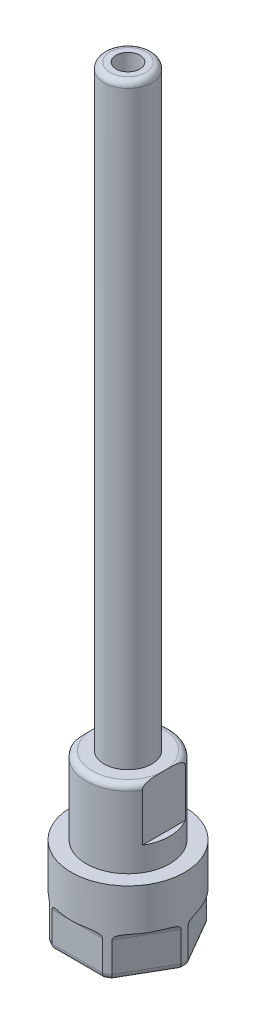
from build123d import *

# Parameters (mm, degrees)
ESQUISSE2_R             = 4
ENL_V_MAT_EXTRU_1_DEPTH = 8
ENL_V_START             = -9
ENL_V_MAT_EXTRU_2_DEPTH = 9
ESQUISSE4_R             = 15
ENL_V_MAT_EXTRU_3_DEPTH = 7
CONG_1_R                = 1


with BuildPart() as part:
    # Esquisse1 → Révolution1 (revolve)
    with BuildSketch(Plane.XY, mode=Mode.PRIVATE) as r_volution1_sk:
        Polygon((4, 127), (4, 27), (7, 27), (7, 14), (9.5, 14), (9.5, 0), (0, 0), (0, 121), (2, 123), (2, 127), align=None)
    revolve(r_volution1_sk.sketch.rotate(Axis((0, 0, 0), (0, 1, 0)), 90), axis=Axis((0, 0, 0), (0, 1, 0)))

    # Esquisse2 → Enlèv. mat.-Extru.1 (cut)
    with BuildSketch(Plane.XZ):
        with Locations(Location((0, 0, 0), (0, 0, 270))):
            Circle(ESQUISSE2_R)
    extrude(amount=-ENL_V_MAT_EXTRU_1_DEPTH, mode=Mode.SUBTRACT)

    # Esquisse3 → Enlèv. mat.-Extru.2 (cut)
    with BuildSketch(Plane(origin=(0, 27, 0), x_dir=(1, 0, 0), z_dir=(0, 1, 0)).offset(ENL_V_START)):
        with BuildLine():
            Line((6, -3.605551275), (6, 3.605551275))
            ThreePointArc((6, 3.605551275), (7, 0), (6, -3.605551275))
        make_face()
        with BuildLine():
            Line((-6, -3.605551275), (-6, 3.605551275))
            ThreePointArc((-6, 3.605551275), (-7, 0), (-6, -3.605551275))
        make_face()
    extrude(amount=ENL_V_MAT_EXTRU_2_DEPTH, mode=Mode.SUBTRACT)

    # Esquisse4 → Enlèv. mat.-Extru.3 (cut)
    with BuildSketch(Plane.XZ):
        Circle(ESQUISSE4_R)
        Polygon((9.814954576, 0), (4.907477288, 8.5), (-4.907477288, 8.5), (-9.814954576, 0), (-4.907477288, -8.5), (4.907477288, -8.5), align=None, mode=Mode.SUBTRACT)
    extrude(amount=-ENL_V_MAT_EXTRU_3_DEPTH, mode=Mode.SUBTRACT)

    # Congé1
    cong_1_edges = [part.edges().sort_by_distance(p)[0] for p in [
        (0, 127, 4),
        (-3.446820352, 27, -6.092571663),
        (0, 27, 7),
        (0, 0, -8.5),
        (-4.75, 0, -8.227241336),
        (-7.361215932, 0, -4.25),
        (-9.5, 0, 0),
        (-7.361215932, 0, 4.25),
        (-4.75, 0, 8.227241336),
        (0, 0, 8.5),
        (4.75, 0, 8.227241336),
        (7.361215932, 0, 4.25),
        (9.5, 0, 0),
        (7.361215932, 0, -4.25),
        (4.75, 0, -8.227241336),
        (0, 0, 4),
        (0, 7, 8.5),
        (7.361215932, 7, 4.25),
        (7.361215932, 7, -4.25),
        (0, 7, -8.5),
        (-7.361215932, 7, -4.25),
        (-7.361215932, 7, 4.25),
    ]]
    fillet(cong_1_edges, radius=CONG_1_R - 0.0001)  # a hair under: the kernel refuses the full size


solid = part.part
